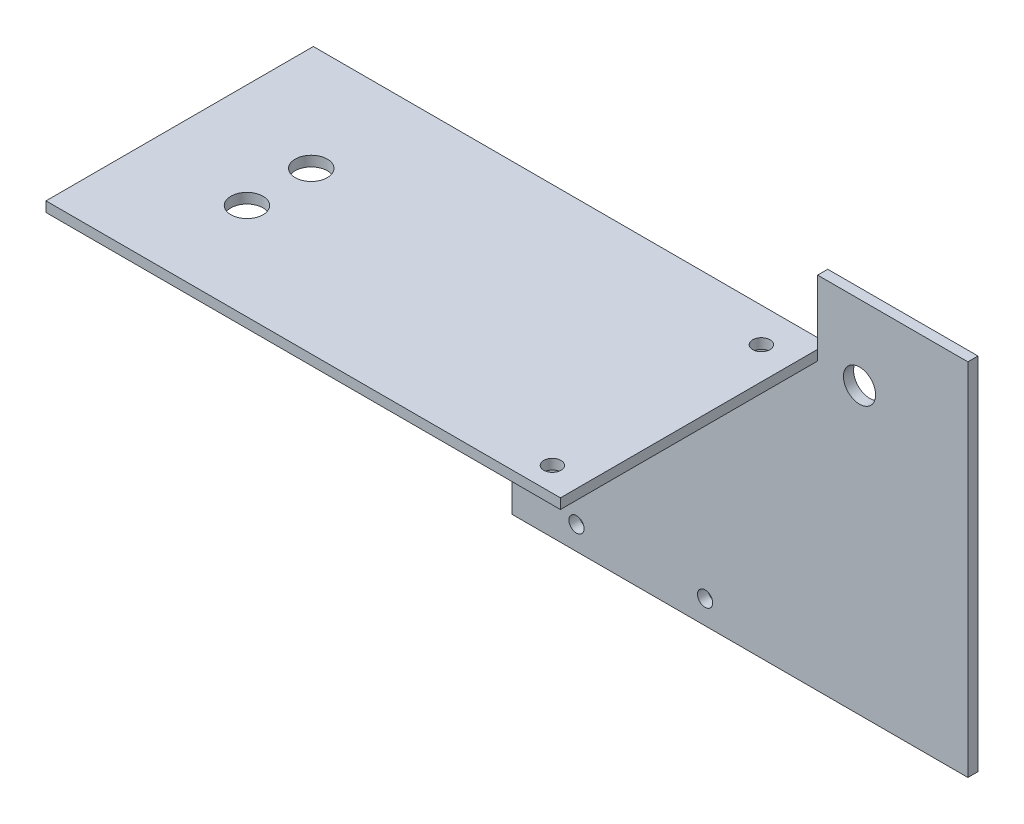
from build123d import *

# Parameters (mm, degrees)
SKETCH1_R           = 3.175
SKETCH1_R_2         = 1.5
BOSS_EXTRUDE1_DEPTH = 2
BOSS_EXTRUDE2_DEPTH = 52.8
SKETCH3_R           = 1.7
SKETCH3_R_2         = 3.175
CUT_EXTRUDE1_DEPTH  = 119.706360402


with BuildPart() as part:
    # Sketch1 → Boss-Extrude1 (new body)
    with BuildSketch(Plane.XY):
        Polygon((0, 58.4), (60.325, 58.4), (60.325, 71.1), (90, 71.1), (90, 58.4), (90, 0), (0, 0), align=None)
        with Locations((68.6, 56.33204182)):
            Circle(SKETCH1_R, mode=Mode.SUBTRACT)
        with Locations((12.7, 51.75)):
            Circle(SKETCH1_R_2, mode=Mode.SUBTRACT)
        with Locations((38.1, 51.75)):
            Circle(SKETCH1_R_2, mode=Mode.SUBTRACT)
        with Locations((12.7, 4.65)):
            Circle(SKETCH1_R_2, mode=Mode.SUBTRACT)
        with Locations((38.1, 4.65)):
            Circle(SKETCH1_R_2, mode=Mode.SUBTRACT)
    extrude(amount=-BOSS_EXTRUDE1_DEPTH)

    # Sketch2 → Boss-Extrude2 (add)
    with BuildSketch(Plane(origin=(0, 0, -2), x_dir=(-1, 0, 0), z_dir=(0, 0, -1))):
        Polygon((0, 56.4), (41.275, 56.4), (41.275, 58.4), (0, 58.4), (-60.325, 58.4), (-60.325, 56.4), align=None)
    extrude(amount=-BOSS_EXTRUDE2_DEPTH)

    # Sketch3 → Cut-Extrude1 (cut, through all)
    with BuildSketch(Plane(origin=(0, 58.4, 0), x_dir=(1, 0, 0), z_dir=(0, 1, 0))):
        with Locations((53.975, -4.7625)):
            Circle(SKETCH3_R)
        with Locations((53.975, -46.0375)):
            Circle(SKETCH3_R)
        with Locations((-20.6375, -31.75)):
            Circle(SKETCH3_R_2)
        with Locations((-20.6375, -19.05)):
            Circle(SKETCH3_R_2)
    extrude(amount=-CUT_EXTRUDE1_DEPTH, mode=Mode.SUBTRACT)


solid = part.part
